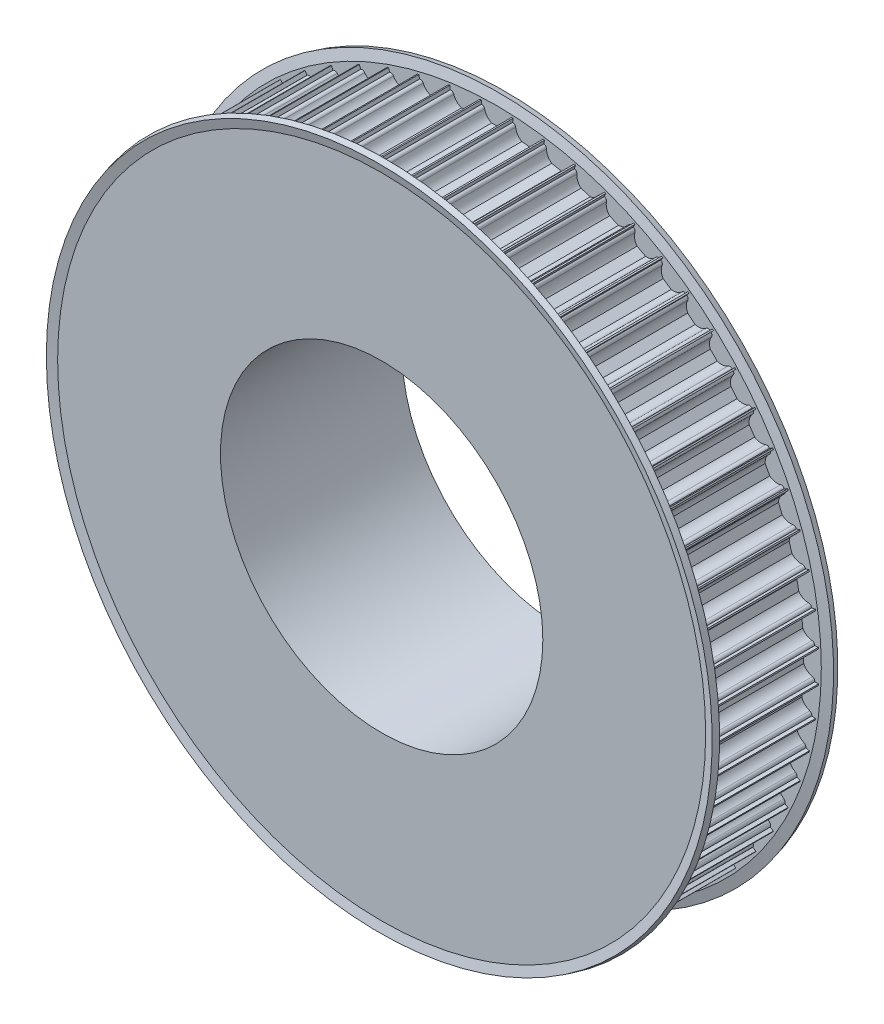
from build123d import *

# Parameters (mm, degrees)
CUT_EXTRUDE1_REACH = 123.758
CIRPATTERN1_COUNT  = 64


with BuildPart() as part:
    # Sketch2 → Revolve1 (revolve)
    with BuildSketch(Plane(origin=(0, 0, 0), x_dir=(0, 0, -1), z_dir=(1, 0, 0))):
        Polygon((0, 40), (0, 80), (30, 80), (30, 55.5), (45, 55.5), (45, 40), align=None)
    revolve(axis=Axis((0, 0, 0), (0, 0, -1)))

    # Sketch3 → Cut-Extrude1 (cut, up to next)
    with BuildSketch(Plane.XY, mode=Mode.PRIVATE) as cut_extrude1_sk1:
        with BuildLine():
            Line((-3.674234614, 79), (-3.75, 79))
            Line((-3.75, 79), (-3.75, 81))
            Line((-3.75, 81), (3.75, 81))
            Line((3.75, 81), (3.75, 79))
            Line((3.75, 79), (3.674234614, 79))
            ThreePointArc((3.674234614, 79), (3.199892965, 78.830947502), (2.939387691, 78.4))
            ThreePointArc((2.939387691, 78.4), (2.331759211, 77.112435701), (1.198957881, 76.25))
            Line((1.198957881, 76.25), (-1.198957881, 76.25))
            ThreePointArc((-1.198957881, 76.25), (-2.331759211, 77.112435701), (-2.939387691, 78.4))
            ThreePointArc((-2.939387691, 78.4), (-3.199892965, 78.830947502), (-3.674234614, 79))
        make_face()
    cut_extrude1_tool1 = extrude(cut_extrude1_sk1.sketch, amount=-CUT_EXTRUDE1_REACH, mode=Mode.PRIVATE) & part.part
    cut_extrude1 = cut_extrude1_tool1.solids().sort_by_distance((0, 78.935169, 0))[0]
    add(cut_extrude1, mode=Mode.SUBTRACT)

    # CirPattern1: Cut-Extrude1 ×64 about axis
    cirpattern1_axis = Axis((0, 0, 0), (0, 0, 1))
    for i in range(1, CIRPATTERN1_COUNT):
        add(cut_extrude1.rotate(cirpattern1_axis, i * 360 / CIRPATTERN1_COUNT), mode=Mode.SUBTRACT)

    # Sketch4 → Revolve2 (revolve)
    with BuildSketch(Plane(origin=(0, 0, 0), x_dir=(0, 0, -1), z_dir=(1, 0, 0))):
        Polygon((30, 55.5), (30, 80.412521254), (30.591966801, 82.621771432), (29.143078062, 83.01), (28.5, 80.61), (28.5, 55.5), align=None)
        Polygon((1.5, 55.5), (0, 55.5), (0, 80.412521254), (-0.591966801, 82.621771432), (0.856921938, 83.01), (1.5, 80.61), align=None)
    revolve(axis=Axis((0, 0, 0), (0, 0, 1)))


solid = part.part
